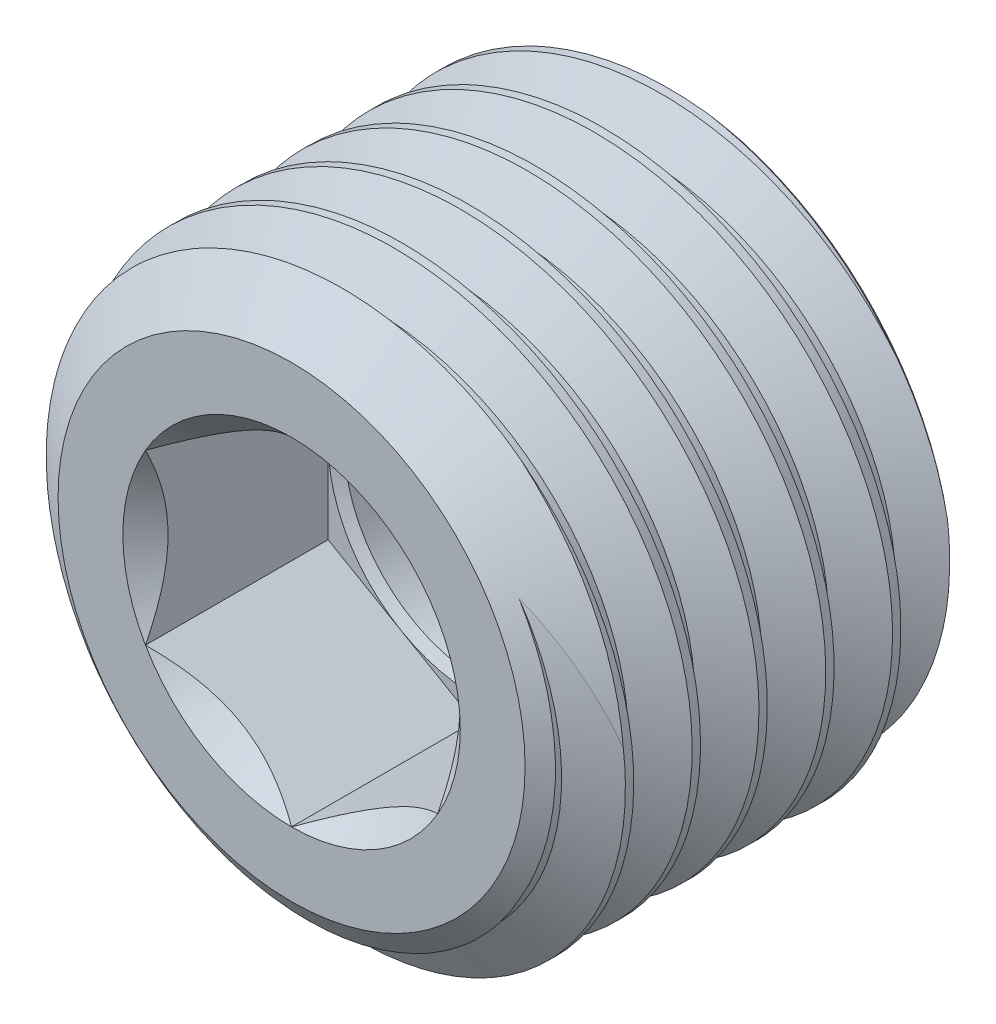
from build123d import *

# Parameters (mm, degrees)
CUT_SWEEP2_PITCH                 = 1.27
CUT_EXTRUDE10_DEPTH              = 3.47265625
F_13_64_0_20313_DIAMETER_HOLE1_D = 5.159502
SKETCH35_W                       = 4.536853299
SKETCH35_H                       = 7.630040881


with BuildPart() as part:
    # Sketch22 → Revolve1 (revolve)
    with BuildSketch(Plane(origin=(0, 0, 0), x_dir=(0, 0, -1), z_dir=(1, 0, 0)), mode=Mode.PRIVATE) as revolve1_sk:
        Polygon((-3.848846234, 0), (-3.848846234, 4.43992), (-3.071629871, 5.5499), (3.167404199, 5.5499), (5.676153766, 3.041150433), (3.848846234, 0), align=None)
    revolve(revolve1_sk.sketch.rotate(Axis((0, 0, -3.848846234), (0, 0, -1)), 180), axis=Axis((0, 0, -3.848846234), (0, 0, -1)))

    # Cut-Sweep2: the profile of Sketch28 profile screwed along a right-hand helix of 9.96 turns, 8 arcs to a turn; built about Z, then put on its axis
    cut_sweep2_z = Axis((0, 0, 0), (0, 0, 1))
    cut_sweep2_corners = [(0, 5.5502, 0.000173205), (0, 5.5502, -1.111423205), (0, 4.780003416, -0.66675), (0, 4.780003416, -0.4445)]
    with BuildLine(mode=Mode.PRIVATE) as cut_sweep2_profile:
        Line(cut_sweep2_corners[0], cut_sweep2_corners[1])
        Line(cut_sweep2_corners[1], cut_sweep2_corners[2])
        Line(cut_sweep2_corners[2], cut_sweep2_corners[3])
        Line(cut_sweep2_corners[3], cut_sweep2_corners[0])
    cut_sweep2_cap = Face(cut_sweep2_profile.wire())
    cut_sweep2_turn_angles = [0, 22.5, 45, 67.5, 90, 112.5, 135, 157.5, 180, 202.5, 225, 247.5, 270, 292.5, 315, 337.5, 360]
    cut_sweep2_turn_weights = [1, 0.9238795325112867, 1, 0.9238795325112867, 1, 0.9238795325112867, 1, 0.9238795325112867, 1, 0.9238795325112867, 1, 0.9238795325112867, 1, 0.9238795325112867, 1, 0.9238795325112867, 1]
    cut_sweep2_turn_rails = [Edge.make_bspline([Vector(p[0], p[1], 0).rotate(cut_sweep2_z, cut_sweep2_turn_angles[k]) / cut_sweep2_turn_weights[k] + Vector(0, 0, p[2] + CUT_SWEEP2_PITCH * cut_sweep2_turn_angles[k] / 360) for k in range(17)], [0, 0, 0, 1, 1, 2, 2, 3, 3, 4, 4, 5, 5, 6, 6, 7, 7, 8, 8, 8], 2, cut_sweep2_turn_weights) for p in cut_sweep2_corners]
    cut_sweep2_turn_sides = [Face.make_surface_from_curves(cut_sweep2_turn_rails[p[0]], cut_sweep2_turn_rails[p[1]]) for p in [(0, 1), (1, 2), (2, 3), (3, 0)]]
    cut_sweep2_last_angles = [3240, 3262.5, 3285, 3307.5, 3330, 3352.5, 3375, 3397.5, 3420, 3442.5, 3465, 3487.5, 3510, 3532.5, 3555, 3570.3, 3585.6]
    cut_sweep2_last_weights = [1, 0.9238795325112867, 1, 0.9238795325112867, 1, 0.9238795325112867, 1, 0.9238795325112867, 1, 0.9238795325112867, 1, 0.9238795325112867, 1, 0.9238795325112867, 1, 0.964557418457746, 1]
    cut_sweep2_last_rails = [Edge.make_bspline([Vector(p[0], p[1], 0).rotate(cut_sweep2_z, cut_sweep2_last_angles[k]) / cut_sweep2_last_weights[k] + Vector(0, 0, p[2] + CUT_SWEEP2_PITCH * cut_sweep2_last_angles[k] / 360) for k in range(17)], [0, 0, 0, 1, 1, 2, 2, 3, 3, 4, 4, 5, 5, 6, 6, 7, 7, 8, 8, 8], 2, cut_sweep2_last_weights) for p in cut_sweep2_corners]
    cut_sweep2_last_sides = [Face.make_surface_from_curves(cut_sweep2_last_rails[p[0]], cut_sweep2_last_rails[p[1]]) for p in [(0, 1), (1, 2), (2, 3), (3, 0)]]
    cut_sweep2 = Plane(origin=(0, 0, -5.676153766), x_dir=(1, 0, 0), z_dir=(0, 0, 1)) * Solid(Shell([*[p.moved(Location((0, 0, CUT_SWEEP2_PITCH * i))) for i in range(9) for p in cut_sweep2_turn_sides], *cut_sweep2_last_sides, cut_sweep2_cap, cut_sweep2_cap.rotate(cut_sweep2_z, 3585.6).moved(Location((0, 0, CUT_SWEEP2_PITCH * 3585.6 / 360)))]))
    add(cut_sweep2, mode=Mode.SUBTRACT)

    # Sketch23 → Cut-Extrude10 (cut)
    with BuildSketch(Plane.XY.offset(3.848846234)):
        Polygon((0, 3.207902433), (-2.778125, 1.603951217), (-2.778125, -1.603951217), (0, -3.207902433), (2.778125, -1.603951217), (2.778125, 1.603951217), align=None)
    extrude(amount=-CUT_EXTRUDE10_DEPTH, mode=Mode.SUBTRACT)

    # Cut-Extrude11 cone 1 section (through the dimple's axis) → Cut-Extrude11 (revolve, cut)
    with BuildSketch(Plane(origin=(0, 0, 3.848846234), x_dir=(0, -1, 0), z_dir=(1, 0, 0))):
        Polygon((0, 0), (3.207902433, 0), (0, 3.207902433), align=None)
    revolve(axis=Axis((0, 0, 3.848846234), (0, 0, -1)), mode=Mode.SUBTRACT)

    # Cut-Extrude12 cone 1 section (through the dimple's axis) → Cut-Extrude12 (revolve, cut)
    with BuildSketch(Plane(origin=(0, 0, 0.376189984), x_dir=(0, -1, 0), z_dir=(1, 0, 0))):
        Polygon((0, 0), (2.778125, 0), (0, 1.603951217), align=None)
    revolve(axis=Axis((0, 0, 0.376189984), (0, 0, -1)), mode=Mode.SUBTRACT)

    # 13/64 (0.20313) Diameter Hole1 (through all)
    with Locations(Plane.XY.offset(3.848846234)):
        with Locations((0, 0)):
            Hole(F_13_64_0_20313_DIAMETER_HOLE1_D / 2)

    # Sketch35 → Cut-Revolve1 (revolve, cut)
    with BuildSketch(Plane(origin=(0, 0, 0), x_dir=(0, 0, -1), z_dir=(1, 0, 0)), mode=Mode.PRIVATE) as cut_revolve1_sk:
        with Locations((5.493480416, 3.815020441)):
            Rectangle(SKETCH35_W, SKETCH35_H)
    revolve(cut_revolve1_sk.sketch.rotate(Axis((0, 0, -3.225053766), (0, 0, 1)), 270), axis=Axis((0, 0, -3.225053766), (0, 0, 1)), mode=Mode.SUBTRACT)


solid = part.part
